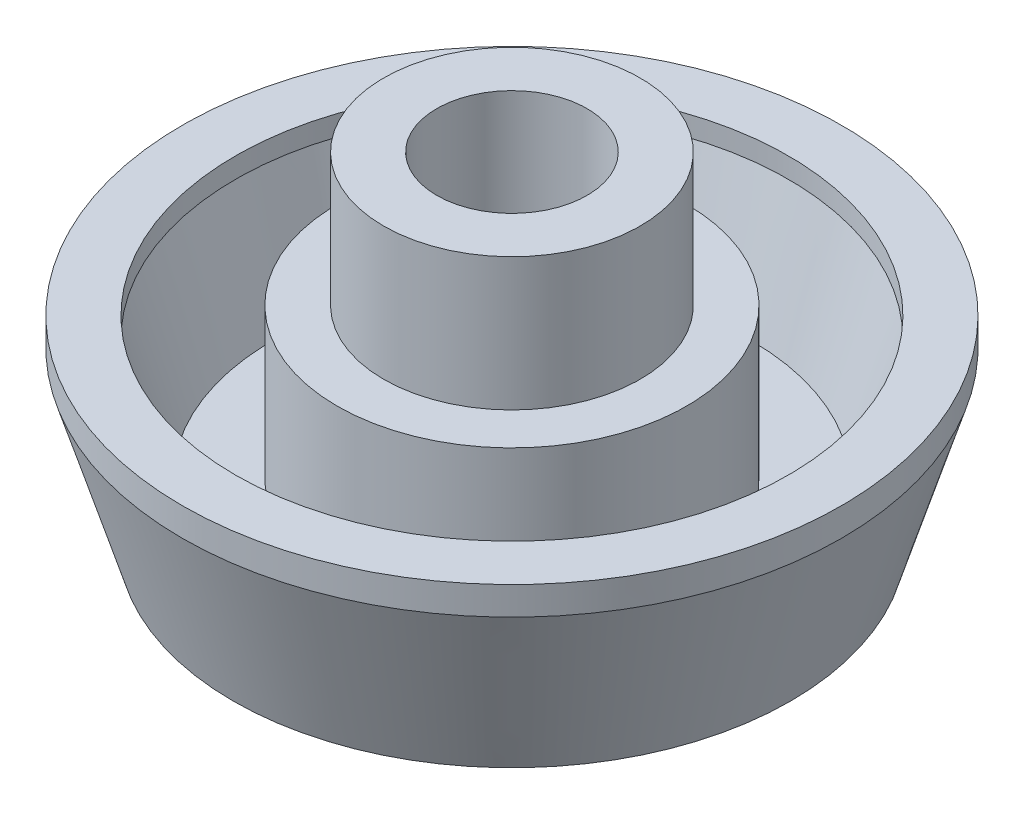
from build123d import *

# Parameters (mm, degrees)
SKETCH1_R           = 7.45
BOSS_EXTRUDE1_DEPTH = 4.4
SKETCH2_R           = 2.95
CUT_EXTRUDE1_DEPTH  = 3.4
SKETCH3_OUTSIDE_W   = 24.262
SKETCH3_OUTSIDE_H   = 24.262
SKETCH3_OUTSIDE_R   = 6.3
CUT_EXTRUDE2_DEPTH  = 5
CUT_EXTRUDE2_DRAFT  = -17
SHELL1_2_OUTLINE_W  = 4.15
SHELL1_2_OUTLINE_H  = 0.2
CUT_EXTRUDE3_START  = -3.4
SKETCH4_R           = 4.15
SKETCH4_R_2         = 3.95
CUT_EXTRUDE3_DEPTH  = 3.4
SKETCH5_R           = 2.9
BOSS_EXTRUDE2_DEPTH = 3
SKETCH6_R           = 1.7
CUT_EXTRUDE4_DEPTH  = 3.3


# Read off the part's stored shape, not the designer's step: Shell1
with BuildPart() as part:
    # Sketch1 → Boss-Extrude1 (new body)
    with BuildSketch(Plane(origin=(0, 0, 0), x_dir=(1, 0, 0), z_dir=(0, 1, 0))):
        with Locations(Location((0, 0, 0), (0, 0, 270))):
            Circle(SKETCH1_R)
    extrude(amount=BOSS_EXTRUDE1_DEPTH)

    # Sketch2 → Cut-Extrude1 (cut)
    with BuildSketch(Plane.XZ):
        with Locations(Location((0, 0, 0), (0, 0, 270))):
            Circle(SKETCH2_R)
    extrude(amount=-CUT_EXTRUDE1_DEPTH, mode=Mode.SUBTRACT)


with BuildPart() as cut_extrude2_tool:
    # Sketch3 outside → Cut-Extrude2 (with draft: the straight prism first)
    with BuildSketch(Plane(origin=(0, 0, 0), x_dir=(-1, 0, 0), z_dir=(0, -1, 0))):
        Rectangle(SKETCH3_OUTSIDE_W, SKETCH3_OUTSIDE_H)
        Circle(SKETCH3_OUTSIDE_R, mode=Mode.SUBTRACT)
    extrude(amount=-CUT_EXTRUDE2_DEPTH)
    # Cut-Extrude2: the draft: its side faces are tilted about the plane it starts from
    cut_extrude2_sides = [cut_extrude2_tool.faces().sort_by_distance(p)[0] for p in [
        (0, 2.5, 12.131),
        (-12.131, 2.5, 0),
        (0, 2.5, -12.131),
        (12.131, 2.5, 0),
        (6.3, 2.5, 0),
    ]]
    draft(cut_extrude2_sides, Plane(origin=(0, 0, 0), x_dir=(-1, 0, 0), z_dir=(0, -1, 0)), CUT_EXTRUDE2_DRAFT)


with BuildPart() as part_1:
    add(part.part)

    # Cut-Extrude2: cut by cut_extrude2_tool
    add(cut_extrude2_tool.part, mode=Mode.SUBTRACT)

    # Shell1 outline → Shell1 (revolve, cut)
    with BuildSketch(Plane.XY):
        Polygon((4.15, 4.4), (4.15, 1.2), (5.41204671, 1.2), (6.25, 3.940821713), (6.25, 4.4), align=None)
    revolve(axis=Axis((0, 0, 0), (0, 1, 0)), mode=Mode.SUBTRACT)

    # Shell1 2 outline → Shell1 2 (revolve)
    with BuildSketch(Plane.XY):
        with Locations((2.075, 4.5)):
            Rectangle(SHELL1_2_OUTLINE_W, SHELL1_2_OUTLINE_H)
    revolve(axis=Axis((0, 0, 0), (0, 1, 0)))

    # Sketch4 → Cut-Extrude3 (cut)
    with BuildSketch(Plane(origin=(0, 4.6, 0), x_dir=(1, 0, 0), z_dir=(0, 1, 0)).offset(CUT_EXTRUDE3_START)):
        Circle(SKETCH4_R)
        with Locations(Location((0, 0, 0), (0, 0, 270))):
            Circle(SKETCH4_R_2, mode=Mode.SUBTRACT)
    extrude(amount=CUT_EXTRUDE3_DEPTH, mode=Mode.SUBTRACT)

    # Sketch5 → Boss-Extrude2 (add)
    with BuildSketch(Plane(origin=(0, 4.6, 0), x_dir=(1, 0, 0), z_dir=(0, 1, 0))):
        with Locations(Location((0, 0, 0), (0, 0, 270))):
            Circle(SKETCH5_R)
    extrude(amount=BOSS_EXTRUDE2_DEPTH)

    # Sketch6 → Cut-Extrude4 (cut)
    with BuildSketch(Plane(origin=(0, 7.6, 0), x_dir=(1, 0, 0), z_dir=(0, 1, 0))):
        with Locations(Location((0, 0, 0), (0, 0, 270))):
            Circle(SKETCH6_R)
    extrude(amount=-CUT_EXTRUDE4_DEPTH, mode=Mode.SUBTRACT)


solid = part_1.part
